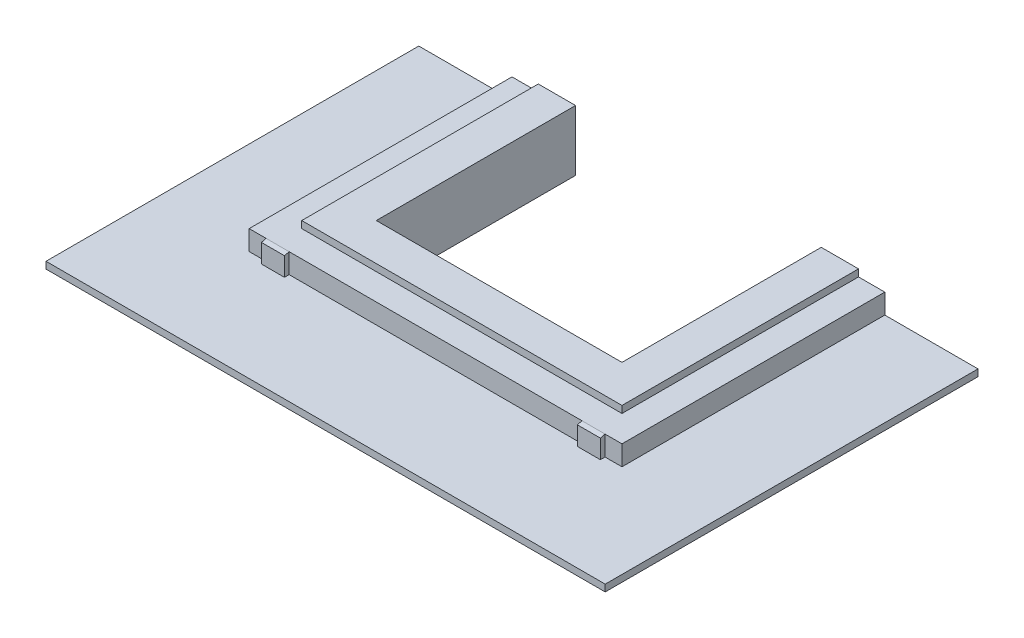
from build123d import *
from OCP.BRepFilletAPI import BRepFilletAPI_MakeChamfer

# Parameters (mm, degrees)
SKETCH1_W                 = 4
SKETCH1_H                 = 0.65
BOSS_EXTRUDE1_DEPTH       = 2.82
CUT_EXTRUDE1_DEPTH        = 0.075
SKETCH3_W                 = 2.636
SKETCH3_H                 = 2.138
CUT_EXTRUDE2_DEPTH        = 4.517797606
BOSS_EXTRUDE2_DEPTH       = 0.025
CHAMFER1_SIZE             = 0.01
SKETCH8_W                 = 0.439976945
SKETCH8_H                 = 0.57304899
CUT_EXTRUDE3_DEPTH        = 0.04
SKETCH9_W                 = 0.585
SKETCH9_H                 = 0.311
BOSS_EXTRUDE3_DEPTH       = 0.07
CHAMFER2_SIZE             = 0.07
CHAMFER2_SIZE_2           = 0.006124206
SKETCH10_W                = 0.284
SKETCH10_H                = 0.14
CUT_EXTRUDE4_DEPTH        = 0.01
CHAMFER3_SIZE             = 0.01
SKETCH11_W                = 0.284
SKETCH11_H                = 0.100875794
BOSS_EXTRUDE4_DEPTH       = 0.05
CUT_EXTRUDE5_REACH        = 5.582
CUT_EXTRUDE6_REACH        = 5.25
SKETCH14_W                = 0.246928611
SKETCH14_H                = 0.5
BOSS_EXTRUDE5_DEPTH       = 0.05
CHAMFER4_SIZE             = 0.05
CHAMFER4_SIZE2            = 0.0124664
CHAMFER4_OF_MIRROR4_SIZE  = 0.05
CHAMFER4_OF_MIRROR4_SIZE2 = 0.0124664
BOSS_EXTRUDE6_START       = -0.25
BOSS_EXTRUDE6_DEPTH       = 0.0364325


# Some blends are built 0.0001 mm under size
with BuildPart() as part:
    # Sketch1 → Boss-Extrude1 (new body)
    with BuildSketch(Plane.XY):
        Rectangle(SKETCH1_W, SKETCH1_H)
    extrude(amount=BOSS_EXTRUDE1_DEPTH)

    # Sketch2 → Cut-Extrude1 (cut)
    with BuildSketch(Plane.XZ.offset(0.325)):
        Polygon((-2, 0), (-1.718, 0), (-1.718, 2.538), (1.718, 2.538), (1.718, 0), (2, 0), (2, 2.82), (-2, 2.82), align=None)
    cut_extrude1 = extrude(amount=-CUT_EXTRUDE1_DEPTH, mode=Mode.SUBTRACT)

    # Sketch3 → Cut-Extrude2 (cut, through all)
    with BuildSketch(Plane.XZ.offset(0.325)):
        with Locations((0, 1.069)):
            Rectangle(SKETCH3_W, SKETCH3_H)
    extrude(amount=-CUT_EXTRUDE2_DEPTH, mode=Mode.SUBTRACT)

    # Mirror1: Cut-Extrude1 across plane
    add(cut_extrude1.mirror(Plane(origin=(0, 0, 0), x_dir=(0, 0, 1), z_dir=(0, -1, 0))), mode=Mode.SUBTRACT)

    # Sketch4 → Boss-Extrude2 (add)
    with BuildSketch(Plane.XZ.offset(0.25)):
        Polygon((-1.788, 2.6805), (-1.718, 2.688), (-1.648, 2.6805), (-1.648, 2.5955), (-1.718, 2.588), (-1.788, 2.5955), align=None)
        Polygon((-0.996, 2.6805), (-0.996, 2.5955), (-0.926, 2.588), (-0.856, 2.5955), (-0.856, 2.6805), (-0.926, 2.688), align=None)
    boss_extrude2 = extrude(amount=BOSS_EXTRUDE2_DEPTH)

    # Mirror2: Boss-Extrude2 across plane
    add(boss_extrude2.mirror(Plane(origin=(0, 0, 0), x_dir=(0, 0, 1), z_dir=(1, 0, 0))))

    # Chamfer1
    chamfer1_edges = [part.edges().sort_by_distance(p)[0] for p in [
        (-0.856, -0.275, 2.638),
        (-0.891, -0.275, 2.68425),
        (1.788, -0.275, 2.638),
        (1.753, -0.275, 2.68425),
        (1.683, -0.275, 2.68425),
        (1.648, -0.275, 2.638),
        (1.683, -0.275, 2.59175),
        (1.753, -0.275, 2.59175),
        (0.961, -0.275, 2.68425),
        (0.891, -0.275, 2.68425),
        (0.856, -0.275, 2.638),
        (0.891, -0.275, 2.59175),
        (0.961, -0.275, 2.59175),
        (0.996, -0.275, 2.638),
        (-1.788, -0.275, 2.638),
        (-1.753, -0.275, 2.59175),
        (-1.683, -0.275, 2.59175),
        (-1.648, -0.275, 2.638),
        (-1.683, -0.275, 2.68425),
        (-1.753, -0.275, 2.68425),
        (-0.961, -0.275, 2.68425),
        (-0.996, -0.275, 2.638),
        (-0.961, -0.275, 2.59175),
        (-0.891, -0.275, 2.59175),
    ]]
    chamfer(chamfer1_edges, length=CHAMFER1_SIZE)

    # Sketch5 → Revolve1 (revolve)
    with BuildSketch(Plane(origin=(0, 0, 0), x_dir=(0, 0, -1), z_dir=(1, 0, 0))):
        with BuildLine():
            Line((-2.749, -0.25), (-2.742875794, -0.32))
            Line((-2.742875794, -0.32), (-2.730380956, -0.32))
            Line((-2.730380956, -0.32), (-2.730380956, -0.373619044))
            ThreePointArc((-2.730380956, -0.373619044), (-2.715331822, -0.409950867), (-2.679, -0.425))
            Line((-2.679, -0.425), (-2.679, -0.25))
            Line((-2.679, -0.25), (-2.749, -0.25))
        make_face()
    revolve(axis=Axis((0, -0.136274993, 2.679), (0, -1, 0)))

    # Sketch6 → Revolve2 (revolve)
    with BuildSketch(Plane.ZY.offset(1.518), mode=Mode.PRIVATE) as revolve2_sk:
        with BuildLine():
            Line((2.488, -0.325), (2.481875794, -0.395))
            Line((2.481875794, -0.395), (2.423, -0.395))
            ThreePointArc((2.423, -0.395), (2.428588355, -0.500546938), (2.338, -0.555))
            Line((2.338, -0.555), (2.338, -0.325))
            Line((2.338, -0.325), (2.488, -0.325))
        make_face()
    revolve2 = revolve(revolve2_sk.sketch.rotate(Axis((-1.518, -0.325, 2.338), (0, -1, 0)), 180), axis=Axis((-1.518, -0.325, 2.338), (0, -1, 0)))

    # Sketch8 → Cut-Extrude3 (cut)
    with BuildSketch(Plane(origin=(0, 0.255528239, 0.093004673), x_dir=(-1, 0, 0), z_dir=(0, -0.9396926207859105, -0.34202014332566305))):
        with Locations((1.555484276, -2.396112054)):
            Rectangle(SKETCH8_W, SKETCH8_H)
    cut_extrude3 = extrude(amount=-CUT_EXTRUDE3_DEPTH, mode=Mode.SUBTRACT)

    # Mirror3: Revolve2, Cut-Extrude3 across plane
    add(revolve2.mirror(Plane(origin=(0, 0, 0), x_dir=(0, 0, 1), z_dir=(1, 0, 0))))
    add(cut_extrude3.mirror(Plane(origin=(0, 0, 0), x_dir=(0, 0, 1), z_dir=(1, 0, 0))), mode=Mode.SUBTRACT)

    # Sketch9 → Boss-Extrude3 (add)
    with BuildSketch(Plane.XZ.offset(0.325)):
        with Locations((0, 2.338)):
            Rectangle(SKETCH9_W, SKETCH9_H)
    extrude(amount=BOSS_EXTRUDE3_DEPTH)

    # Chamfer2
    # the kernel refuses this chamfer: 0.07, 0.006124206 mm, written as the material it takes off along each edge
    with BuildSketch(Plane(origin=(-0.474474386, -0.395, 2.4935), x_dir=(0, 0.9999943799678763, 0.00335261579403213), z_dir=(1, 0, 0))) as chamfer2_piece_1_section:
        Polygon((CHAMFER2_SIZE * 0.999994379968, -CHAMFER2_SIZE * 0.00335261579403), (-CHAMFER2_SIZE_2 * 0.00335261603863, -CHAMFER2_SIZE_2 * 0.999994452926), (0, 0), align=None)
    chamfer2_piece_1 = extrude(amount=0.948948771, mode=Mode.PRIVATE)
    chamfer2_piece_1 = split(chamfer2_piece_1, bisect_by=Plane(origin=(0, -0.325, 2.492252254), z_dir=(0, -1, 0)), keep=Keep.TOP, mode=Mode.PRIVATE)
    add(chamfer2_piece_1, mode=Mode.SUBTRACT)
    with BuildSketch(Plane(origin=(0.2925, -0.395, 2.675474386), x_dir=(0.003352615794032893, 0.9999943799678763, 0), z_dir=(0, 0, -1))) as chamfer2_piece_2_section:
        Polygon((CHAMFER2_SIZE * 0.999994379968, -CHAMFER2_SIZE * 0.00335261579403), (-CHAMFER2_SIZE_2 * 0.00335261603864, -CHAMFER2_SIZE_2 * 0.999994452926), (0, 0), align=None)
    chamfer2_piece_2 = extrude(amount=0.674948771, mode=Mode.PRIVATE)
    chamfer2_piece_2 = split(chamfer2_piece_2, bisect_by=Plane(origin=(0.291252254, -0.325, 2.338), z_dir=(0, -1, 0)), keep=Keep.TOP, mode=Mode.PRIVATE)
    add(chamfer2_piece_2, mode=Mode.SUBTRACT)
    with BuildSketch(Plane(origin=(0.474474386, -0.395, 2.1825), x_dir=(0, 0.9999943799678763, -0.00335261579403213), z_dir=(-1, 0, 0))) as chamfer2_piece_3_section:
        Polygon((CHAMFER2_SIZE * 0.999994379968, -CHAMFER2_SIZE * 0.00335261579403), (-CHAMFER2_SIZE_2 * 0.00335261603863, -CHAMFER2_SIZE_2 * 0.999994452926), (0, 0), align=None)
    chamfer2_piece_3 = extrude(amount=0.948948771, mode=Mode.PRIVATE)
    chamfer2_piece_3 = split(chamfer2_piece_3, bisect_by=Plane(origin=(0, -0.325, 2.183747746), z_dir=(0, -1, 0)), keep=Keep.TOP, mode=Mode.PRIVATE)
    add(chamfer2_piece_3, mode=Mode.SUBTRACT)
    with BuildSketch(Plane(origin=(-0.2925, -0.395, 2.000525614), x_dir=(-0.003352615794032893, 0.9999943799678763, 0), z_dir=(0, 0, 1))) as chamfer2_piece_4_section:
        Polygon((CHAMFER2_SIZE * 0.999994379968, -CHAMFER2_SIZE * 0.00335261579403), (-CHAMFER2_SIZE_2 * 0.00335261603864, -CHAMFER2_SIZE_2 * 0.999994452926), (0, 0), align=None)
    chamfer2_piece_4 = extrude(amount=0.674948771, mode=Mode.PRIVATE)
    chamfer2_piece_4 = split(chamfer2_piece_4, bisect_by=Plane(origin=(-0.291252254, -0.325, 2.338), z_dir=(0, -1, 0)), keep=Keep.TOP, mode=Mode.PRIVATE)
    add(chamfer2_piece_4, mode=Mode.SUBTRACT)

    # Sketch10 → Cut-Extrude4 (cut)
    with BuildSketch(Plane.XZ.offset(0.395)):
        with Locations((0, 2.3165)):
            Rectangle(SKETCH10_W, SKETCH10_H)
    extrude(amount=-CUT_EXTRUDE4_DEPTH, mode=Mode.SUBTRACT)

    # Chamfer3
    chamfer3_edges = [part.edges().sort_by_distance(p)[0] for p in [
        (0, -0.385, 2.3865),
        (0.142, -0.385, 2.3165),
        (0, -0.385, 2.2465),
        (-0.142, -0.385, 2.3165),
    ]]
    chamfer(chamfer3_edges, length=CHAMFER3_SIZE - 0.0001)  # a hair under: the kernel refuses the full size

    # Sketch11 → Boss-Extrude4 (add)
    with BuildSketch(Plane.XZ.offset(0.395)):
        with Locations((0, 2.436937897)):
            Rectangle(SKETCH11_W, SKETCH11_H)
    extrude(amount=BOSS_EXTRUDE4_DEPTH)

    # Sketch12 → Cut-Extrude5 (cut, up to next)
    with BuildSketch(Plane(origin=(0.142, 0, 0), x_dir=(0, 0, -1), z_dir=(1, 0, 0)), mode=Mode.PRIVATE) as cut_extrude5_sk1:
        Polygon((-2.487375794, -0.445), (-2.487375794, -0.395), (-2.418578899, -0.445), align=None)
    cut_extrude5_tool1 = extrude(cut_extrude5_sk1.sketch, amount=-CUT_EXTRUDE5_REACH, mode=Mode.PRIVATE) & part.part
    # Sketch12 → Cut-Extrude5 (cut, up to next)
    with BuildSketch(Plane(origin=(0.142, 0, 0), x_dir=(0, 0, -1), z_dir=(1, 0, 0)), mode=Mode.PRIVATE) as cut_extrude5_sk2:
        Polygon((-2.3865, -0.395), (-2.410536518, -0.445), (-2.3865, -0.445), align=None)
    cut_extrude5_tool2 = extrude(cut_extrude5_sk2.sketch, amount=-CUT_EXTRUDE5_REACH, mode=Mode.PRIVATE) & part.part
    add(cut_extrude5_tool1.solids().sort_by_distance((0.142, -0.428333, 2.464443))[0], mode=Mode.SUBTRACT)
    add(cut_extrude5_tool2.solids().sort_by_distance((0.142, -0.428333, 2.394512))[0], mode=Mode.SUBTRACT)

    # Sketch13 → Cut-Extrude6 (cut, up to next)
    with BuildSketch(Plane(origin=(0, -0.218964606, 2.502776895), x_dir=(1, 0, 0), z_dir=(0, -0.08715574274765381, 0.996194698091746)), mode=Mode.PRIVATE) as cut_extrude6_sk1:
        Polygon((-0.142, -0.19770153), (-0.126414627, -0.23321454), (-0.142, -0.23321454), align=None)
    cut_extrude6_tool1 = extrude(cut_extrude6_sk1.sketch, amount=-CUT_EXTRUDE6_REACH, mode=Mode.PRIVATE) & part.part
    # Sketch13 → Cut-Extrude6 (cut, up to next)
    with BuildSketch(Plane(origin=(0, -0.218964606, 2.502776895), x_dir=(1, 0, 0), z_dir=(0, -0.08715574274765381, 0.996194698091746)), mode=Mode.PRIVATE) as cut_extrude6_sk2:
        Polygon((0.142, -0.19770153), (0.126414627, -0.23321454), (0.142, -0.23321454), align=None)
    cut_extrude6_tool2 = extrude(cut_extrude6_sk2.sketch, amount=-CUT_EXTRUDE6_REACH, mode=Mode.PRIVATE) & part.part
    add(cut_extrude6_tool1.solids().sort_by_distance((-0.136805, -0.439499, 2.483483))[0], mode=Mode.SUBTRACT)
    add(cut_extrude6_tool2.solids().sort_by_distance((0.136805, -0.439499, 2.483483))[0], mode=Mode.SUBTRACT)

    # Sketch14 → Boss-Extrude5 (add)
    with BuildSketch(Plane.XY.offset(2.82)):
        with Locations((-1.694754599, 0)):
            Rectangle(SKETCH14_W, SKETCH14_H)
    boss_extrude5 = extrude(amount=BOSS_EXTRUDE5_DEPTH)

    # Chamfer4: one chamfer whose edges measure the first distance from different faces: ONE call of the kernel's chamfer builder (chamfer() names one face for all edges)
    chamfer4_edges_1 = [part.edges().sort_by_distance(p)[0] for p in [
        (-1.694754599, 0.25, 2.87),
    ]]
    chamfer4_side_1 = [part.faces().sort_by_distance(p)[0] for p in [
        (-1.859, 0.25, 0.049230986),
    ]]
    chamfer4_edges_2 = [part.edges().sort_by_distance(p)[0] for p in [
        (-1.694754599, -0.25, 2.87),
    ]]
    chamfer4_side_2 = [part.faces().sort_by_distance(p)[0] for p in [
        (-1.859, -0.25, 0.049230986),
    ]]
    chamfer4 = BRepFilletAPI_MakeChamfer(part.part.solid().wrapped)
    for e in chamfer4_edges_1:
        chamfer4.Add(CHAMFER4_SIZE, CHAMFER4_SIZE2, e.wrapped, chamfer4_side_1[0].wrapped)  # the first distance lies on this face
    for e in chamfer4_edges_2:
        chamfer4.Add(CHAMFER4_SIZE, CHAMFER4_SIZE2, e.wrapped, chamfer4_side_2[0].wrapped)  # the first distance lies on this face
    add(Compound.cast(chamfer4.Shape()), mode=Mode.REPLACE)

    # Mirror4: Boss-Extrude5 across plane
    add(boss_extrude5.mirror(Plane(origin=(0, 0, 0), x_dir=(0, 0, 1), z_dir=(1, 0, 0))))

    # Chamfer4 of Mirror4: one chamfer whose edges measure the first distance from different faces: ONE call of the kernel's chamfer builder (chamfer() names one face for all edges)
    chamfer4_of_mirror4_edges_1 = [part.edges().sort_by_distance(p)[0] for p in [
        (1.694754599, 0.25, 2.87),
    ]]
    chamfer4_of_mirror4_side_1 = [part.faces().sort_by_distance(p)[0] for p in [
        (1.859, 0.25, 0.049230986),
    ]]
    chamfer4_of_mirror4_edges_2 = [part.edges().sort_by_distance(p)[0] for p in [
        (1.694754599, -0.25, 2.87),
    ]]
    chamfer4_of_mirror4_side_2 = [part.faces().sort_by_distance(p)[0] for p in [
        (1.859, -0.25, 0.049230986),
    ]]
    chamfer4_of_mirror4 = BRepFilletAPI_MakeChamfer(part.part.solid().wrapped)
    for e in chamfer4_of_mirror4_edges_1:
        chamfer4_of_mirror4.Add(CHAMFER4_OF_MIRROR4_SIZE, CHAMFER4_OF_MIRROR4_SIZE2, e.wrapped, chamfer4_of_mirror4_side_1[0].wrapped)  # the first distance lies on this face
    for e in chamfer4_of_mirror4_edges_2:
        chamfer4_of_mirror4.Add(CHAMFER4_OF_MIRROR4_SIZE, CHAMFER4_OF_MIRROR4_SIZE2, e.wrapped, chamfer4_of_mirror4_side_2[0].wrapped)  # the first distance lies on this face
    add(Compound.cast(chamfer4_of_mirror4.Shape()), mode=Mode.REPLACE)

    # Sketch15 → Boss-Extrude6 (add, symmetric)
    with BuildSketch(Plane.XZ.offset(0.25).offset(BOSS_EXTRUDE6_START)):
        Polygon((-3, 0), (-1.318, 0), (-1.318, 2.138), (1.318, 2.138), (1.318, 0), (3, 0), (3, 4), (-3, 4), align=None)
    extrude(amount=BOSS_EXTRUDE6_DEPTH, both=True)


solid = part.part
